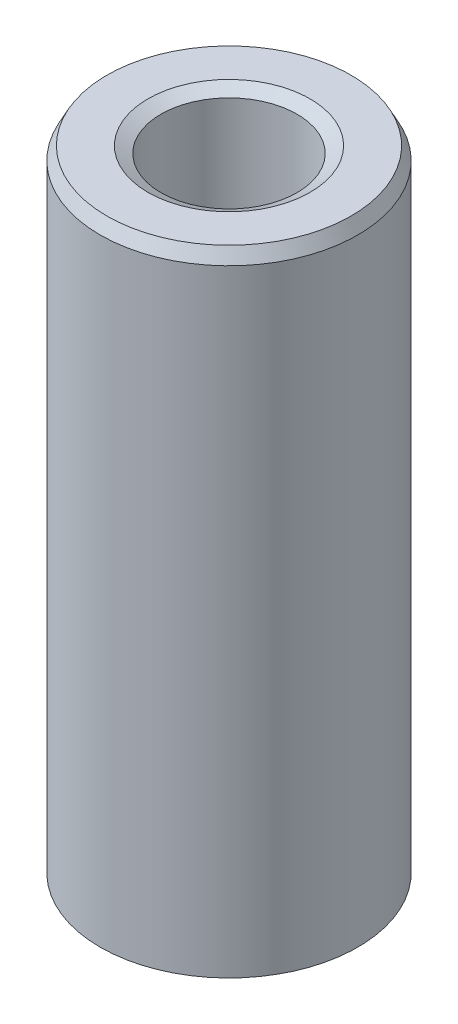
from build123d import *
from OCP.BRepFilletAPI import BRepFilletAPI_MakeChamfer

# Parameters (mm, degrees)
SKETCH1_R           = 5
BOSS_EXTRUDE1_DEPTH = 24.706632628
SKETCH2_R           = 2.641046904
CUT_EXTRUDE1_DEPTH  = 26.698593266
CHAMFER1_SIZE       = 0.505165881
CHAMFER1_SIZE2      = 0.262627622


with BuildPart() as part:
    # Sketch1 → Boss-Extrude1 (new body)
    with BuildSketch(Plane(origin=(0, 0, 0), x_dir=(1, 0, 0), z_dir=(0, 1, 0))):
        Circle(SKETCH1_R)
    extrude(amount=BOSS_EXTRUDE1_DEPTH)

    # Sketch2 → Cut-Extrude1 (cut, through all)
    with BuildSketch(Plane(origin=(0, 0, 0), x_dir=(1, 0, 0), z_dir=(0, 1, 0))):
        Circle(SKETCH2_R)
    extrude(amount=CUT_EXTRUDE1_DEPTH, mode=Mode.SUBTRACT)

    # Chamfer1: one chamfer whose edges measure the first distance from different faces: ONE call of the kernel's chamfer builder (chamfer() names one face for all edges)
    chamfer1_edges_1 = [part.edges().sort_by_distance(p)[0] for p in [
        (-2.641046904, 24.706632628, 0),
    ]]
    chamfer1_side_1 = [part.faces().sort_by_distance(p)[0] for p in [
        (-4.858578644, 24.706632628, 0),
    ]]
    chamfer1_edges_2 = [part.edges().sort_by_distance(p)[0] for p in [
        (-2.641046904, 0, 0),
    ]]
    chamfer1_side_2 = [part.faces().sort_by_distance(p)[0] for p in [
        (-2.641046904, 12.353316314, 0),
    ]]
    chamfer1_edges_3 = [part.edges().sort_by_distance(p)[0] for p in [
        (-5, 0, 0),
    ]]
    chamfer1_side_3 = [part.faces().sort_by_distance(p)[0] for p in [
        (-4.858578644, 0, 0),
    ]]
    chamfer1_edges_4 = [part.edges().sort_by_distance(p)[0] for p in [
        (-5, 24.706632628, 0),
    ]]
    chamfer1_side_4 = [part.faces().sort_by_distance(p)[0] for p in [
        (-5, 12.353316314, 0),
    ]]
    chamfer1 = BRepFilletAPI_MakeChamfer(part.part.solid().wrapped)
    for e in chamfer1_edges_1:
        chamfer1.Add(CHAMFER1_SIZE, CHAMFER1_SIZE2, e.wrapped, chamfer1_side_1[0].wrapped)  # the first distance lies on this face
    for e in chamfer1_edges_2:
        chamfer1.Add(CHAMFER1_SIZE, CHAMFER1_SIZE2, e.wrapped, chamfer1_side_2[0].wrapped)  # the first distance lies on this face
    for e in chamfer1_edges_3:
        chamfer1.Add(CHAMFER1_SIZE, CHAMFER1_SIZE2, e.wrapped, chamfer1_side_3[0].wrapped)  # the first distance lies on this face
    for e in chamfer1_edges_4:
        chamfer1.Add(CHAMFER1_SIZE, CHAMFER1_SIZE2, e.wrapped, chamfer1_side_4[0].wrapped)  # the first distance lies on this face
    add(Compound.cast(chamfer1.Shape()), mode=Mode.REPLACE)


solid = part.part
